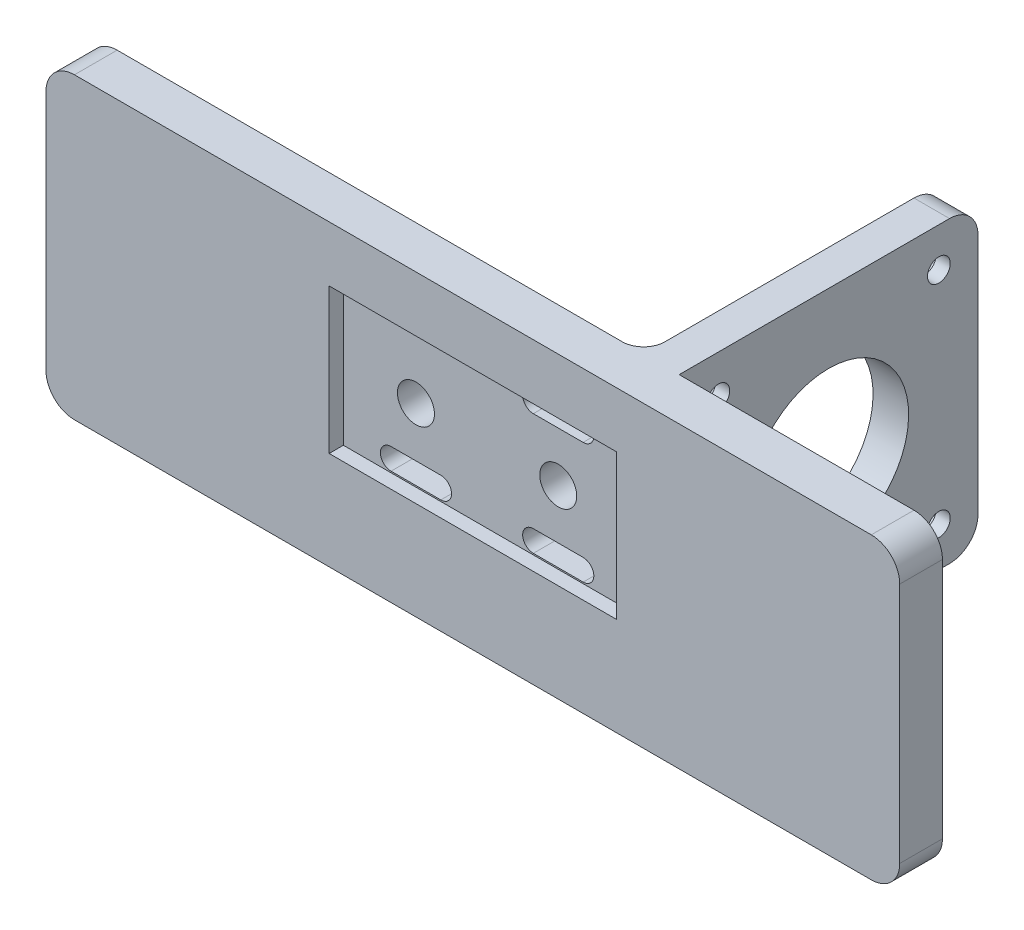
from build123d import *

# Parameters (mm, degrees)
SKETCH1_R               = 2.6
BOSS_EXTRUDE1_DEPTH     = 6
SKETCH8_W               = 40.4
SKETCH8_H               = 20.4
CUT_EXTRUDE4_DEPTH      = 2
SKETCH9_W               = 5
SKETCH9_H               = 42
BOSS_EXTRUDE2_DEPTH     = 42
FILLET1_R               = 4
FILLET2_R               = 3
SKETCH10_R              = 11.25
SKETCH10_R_2            = 1.6
CUT_EXTRUDE5_DEPTH      = 42
CUT_EXTRUDE6_DEPTH      = 3
CUT_EXTRUDE6_DEPTH_BACK = 3
SKETCH11_R              = 2.8


with BuildPart() as part:
    # Sketch1 → Boss-Extrude1 (new body)
    with BuildSketch(Plane.XY):
        with BuildLine():
            Line((-56, -1.5), (20, -1.5))
            Line((20, -1.5), (56, -1.5))
            ThreePointArc((56, -1.5), (58.828427125, -0.328427125), (60, 2.5))
            Line((60, 2.5), (60, 36.5))
            ThreePointArc((60, 36.5), (58.828427125, 39.328427125), (56, 40.5))
            Line((56, 40.5), (-56, 40.5))
            ThreePointArc((-56, 40.5), (-58.828427125, 39.328427125), (-60, 36.5))
            Line((-60, 36.5), (-60, 2.5))
            ThreePointArc((-60, 2.5), (-58.828427125, -0.328427125), (-56, -1.5))
        make_face()
        with Locations((10, 22.5)):
            Circle(SKETCH1_R, mode=Mode.SUBTRACT)
        with Locations((-10, 22.5)):
            Circle(SKETCH1_R, mode=Mode.SUBTRACT)
        with BuildLine():
            Line((-13.5, 15.5), (-6.5, 15.5))
            ThreePointArc((-6.5, 15.5), (-5, 14), (-6.5, 12.5))
            Line((-6.5, 12.5), (-13.5, 12.5))
            ThreePointArc((-13.5, 12.5), (-15, 14), (-13.5, 15.5))
        make_face(mode=Mode.SUBTRACT)
        with BuildLine():
            Line((13.5, 15.5), (6.5, 15.5))
            ThreePointArc((6.5, 15.5), (5, 14), (6.5, 12.5))
            Line((6.5, 12.5), (13.5, 12.5))
            ThreePointArc((13.5, 12.5), (15, 14), (13.5, 15.5))
        make_face(mode=Mode.SUBTRACT)
        with BuildLine():
            Line((13.5, 29.5), (6.5, 29.5))
            ThreePointArc((6.5, 29.5), (5, 31), (6.5, 32.5))
            Line((6.5, 32.5), (13.5, 32.5))
            ThreePointArc((13.5, 32.5), (15, 31), (13.5, 29.5))
        make_face(mode=Mode.SUBTRACT)
    extrude(amount=BOSS_EXTRUDE1_DEPTH)

    # Sketch8 → Cut-Extrude4 (cut)
    with BuildSketch(Plane.XY.offset(6)):
        with Locations((0, 22.5)):
            Rectangle(SKETCH8_W, SKETCH8_H)
    extrude(amount=-CUT_EXTRUDE4_DEPTH, mode=Mode.SUBTRACT)

    # Sketch9 → Boss-Extrude2 (add)
    with BuildSketch(Plane(origin=(0, 0, 0), x_dir=(-1, 0, 0), z_dir=(0, 0, -1))):
        with Locations((-20.5, 19.5)):
            Rectangle(SKETCH9_W, SKETCH9_H)
    extrude(amount=BOSS_EXTRUDE2_DEPTH)

    # Fillet1
    fillet1_edges = [part.edges().sort_by_distance(p)[0] for p in [
        (20.5, 40.5, -42),
        (20.5, -1.5, -42),
    ]]
    fillet(fillet1_edges, radius=FILLET1_R)

    # Fillet2
    fillet2_edges = [part.edges().sort_by_distance(p)[0] for p in [
        (18, 19.5, 0),
    ]]
    fillet(fillet2_edges, radius=FILLET2_R - 0.0001)  # a hair under: the kernel refuses the full size

    # Sketch10 → Cut-Extrude5 (cut)
    with BuildSketch(Plane(origin=(23, 0, 0), x_dir=(0, 0, -1), z_dir=(1, 0, 0))):
        with Locations(Location((21, 19.5, 0), (0, 0, 90))):
            Circle(SKETCH10_R)
        with Locations(Location((5.5, 35, 0), (0, 0, 90))):
            Circle(SKETCH10_R_2)
        with Locations(Location((36.5, 35, 0), (0, 0, 90))):
            Circle(SKETCH10_R_2)
        with Locations(Location((36.5, 4, 0), (0, 0, 90))):
            Circle(SKETCH10_R_2)
        with Locations(Location((5.5, 4, 0), (0, 0, 90))):
            Circle(SKETCH10_R_2)
    extrude(amount=-CUT_EXTRUDE5_DEPTH, mode=Mode.SUBTRACT)

    # Sketch11 → Cut-Extrude6 (cut, two sides: drawn at the far end of the back side and taken through both)
    with BuildSketch(Plane.ZY.offset(-18).offset(-CUT_EXTRUDE6_DEPTH_BACK)):
        with Locations(Location((-36.5, 35, 0), (0, 0, 180))):
            Circle(SKETCH11_R)
        with Locations(Location((-5.5, 35, 0), (0, 0, 26.765500577))):
            Circle(SKETCH11_R)
        with Locations(Location((-5.5, 4, 0), (0, 0, 26.765500577))):
            Circle(SKETCH11_R)
        with Locations(Location((-36.5, 4, 0), (0, 0, 180))):
            Circle(SKETCH11_R)
    extrude(amount=CUT_EXTRUDE6_DEPTH + CUT_EXTRUDE6_DEPTH_BACK, mode=Mode.SUBTRACT)


solid = part.part
